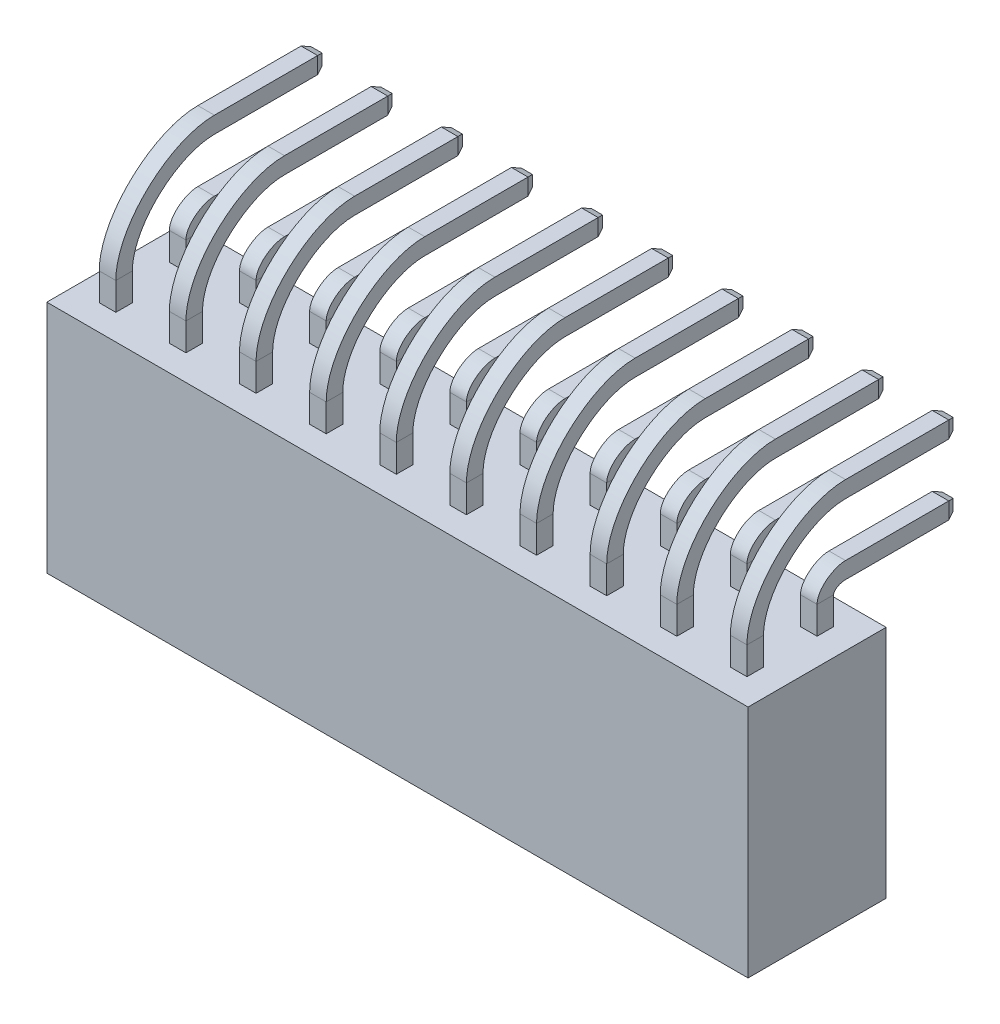
from build123d import *

# Parameters (mm, degrees)
SKETCH_1_W                          = 25.4
SKETCH_1_H                          = 8.5
EXTRUDE_1_DEPTH                     = 5
SKETCH_2_W                          = 0.85
SKETCH_2_H                          = 0.85
CUT_EXTRUDE_1_DEPTH                 = 6
CHAMFER_3_SIZE                      = 0.6
CHAMFER_3_SIZE2                     = 0.48587042
PATTERN_LINEAR_1_COUNT              = 10
PATTERN_LINEAR_1_PITCH              = 2.54
CHAMFER_3_OF_PATTERN_LINEAR_1_SIZE2 = 0.48587042
CHAMFER_3_OF_PATTERN_LINEAR_1_SIZE  = 0.6
SKETCH_3_W                          = 0.6
SKETCH_3_H                          = 0.6
EXTRUDE_2_DEPTH                     = 1
EXTRUDE_2_2_DEPTH                   = 1
EXTRUDE_3_DEPTH                     = 0.5
EXTRUDE_3_DEPTH_BACK                = 3.5
SKETCH_4_W                          = 0.6
SKETCH_4_H                          = 0.6
EXTRUDE_3_2_DEPTH                   = 0.5
EXTRUDE_3_2_DEPTH_BACK              = 3.5
LOFT_START                          = 11.13
LOFT_1_DEPTH                        = 0.6
LOFT_2_DEPTH                        = 0.6
CHAMFER_1_SIZE                      = 0.1
CHAMFER_1_SIZE2                     = 0.260508906
CHAMFER_2_SIZE                      = 0.1
CHAMFER_2_SIZE2                     = 0.260508906
PATTERN_LINEAR_2_COUNT              = 10
PATTERN_LINEAR_2_PITCH              = 2.54


# Read off the part's stored shape, not the designer's step: По сечениям1, По сечениям2
with BuildPart() as part:
    # Эскиз1 → Бобышка-Вытянуть1 (new body)
    with BuildSketch(Plane.XY):
        with Locations((0, -7.08)):
            Rectangle(SKETCH_1_W, SKETCH_1_H)
    extrude(amount=EXTRUDE_1_DEPTH)

    # Эскиз2 → Вырез-Вытянуть1 (cut)
    with BuildSketch(Plane.XZ.offset(11.33)):
        with Locations((11.43, 1.23)):
            Rectangle(SKETCH_2_W, SKETCH_2_H)
        with Locations((11.43, 3.77)):
            Rectangle(SKETCH_2_W, SKETCH_2_H)
    cut_extrude_1 = extrude(amount=-CUT_EXTRUDE_1_DEPTH, mode=Mode.SUBTRACT)

    # Фаска3
    chamfer_3_edges = [part.edges().sort_by_distance(p)[0] for p in [
        (11.855, -11.33, 1.23),
        (11.43, -11.33, 1.655),
        (11.005, -11.33, 1.23),
        (11.43, -11.33, 0.805),
        (11.855, -11.33, 3.77),
        (11.43, -11.33, 4.195),
        (11.005, -11.33, 3.77),
        (11.43, -11.33, 3.345),
    ]]
    chamfer_3_side = [part.faces().sort_by_distance(p)[0] for p in [
        (-0.131546733, -11.33, 2.5),
    ]]
    chamfer(chamfer_3_edges, length=CHAMFER_3_SIZE, length2=CHAMFER_3_SIZE2, reference=chamfer_3_side[0])

    # Линейный массив1: Вырез-Вытянуть1 ×10
    with Locations(*[(-i * PATTERN_LINEAR_1_PITCH, 0, 0) for i in range(1, PATTERN_LINEAR_1_COUNT)]):
        add(cut_extrude_1, mode=Mode.SUBTRACT)

    # Фаска3 of Линейный массив1
    chamfer_3_of_pattern_linear_1_edges = [part.edges().sort_by_distance(p)[0] for p in [
        (9.315, -11.33, 1.23),
        (8.89, -11.33, 1.655),
        (8.465, -11.33, 1.23),
        (8.89, -11.33, 0.805),
        (9.315, -11.33, 3.77),
        (8.89, -11.33, 4.195),
        (8.465, -11.33, 3.77),
        (8.89, -11.33, 3.345),
        (6.775, -11.33, 1.23),
        (6.35, -11.33, 1.655),
        (5.925, -11.33, 1.23),
        (6.35, -11.33, 0.805),
        (6.775, -11.33, 3.77),
        (6.35, -11.33, 4.195),
        (5.925, -11.33, 3.77),
        (6.35, -11.33, 3.345),
        (4.235, -11.33, 1.23),
        (3.81, -11.33, 1.655),
        (3.385, -11.33, 1.23),
        (3.81, -11.33, 0.805),
        (4.235, -11.33, 3.77),
        (3.81, -11.33, 4.195),
        (3.385, -11.33, 3.77),
        (3.81, -11.33, 3.345),
        (1.695, -11.33, 1.23),
        (1.27, -11.33, 1.655),
        (0.845, -11.33, 1.23),
        (1.27, -11.33, 0.805),
        (1.695, -11.33, 3.77),
        (1.27, -11.33, 4.195),
        (0.845, -11.33, 3.77),
        (1.27, -11.33, 3.345),
        (-0.845, -11.33, 1.23),
        (-1.27, -11.33, 1.655),
        (-1.695, -11.33, 1.23),
        (-1.27, -11.33, 0.805),
        (-0.845, -11.33, 3.77),
        (-1.27, -11.33, 4.195),
        (-1.695, -11.33, 3.77),
        (-1.27, -11.33, 3.345),
        (-3.385, -11.33, 1.23),
        (-3.81, -11.33, 1.655),
        (-4.235, -11.33, 1.23),
        (-3.81, -11.33, 0.805),
        (-3.385, -11.33, 3.77),
        (-3.81, -11.33, 4.195),
        (-4.235, -11.33, 3.77),
        (-3.81, -11.33, 3.345),
        (-5.925, -11.33, 1.23),
        (-6.35, -11.33, 1.655),
        (-6.775, -11.33, 1.23),
        (-6.35, -11.33, 0.805),
        (-5.925, -11.33, 3.77),
        (-6.35, -11.33, 4.195),
        (-6.775, -11.33, 3.77),
        (-6.35, -11.33, 3.345),
        (-8.465, -11.33, 1.23),
        (-8.89, -11.33, 1.655),
        (-9.315, -11.33, 1.23),
        (-8.89, -11.33, 0.805),
        (-8.465, -11.33, 3.77),
        (-8.89, -11.33, 4.195),
        (-9.315, -11.33, 3.77),
        (-8.89, -11.33, 3.345),
        (-11.005, -11.33, 1.23),
        (-11.43, -11.33, 1.655),
        (-11.855, -11.33, 1.23),
        (-11.43, -11.33, 0.805),
        (-11.005, -11.33, 3.77),
        (-11.43, -11.33, 4.195),
        (-11.855, -11.33, 3.77),
        (-11.43, -11.33, 3.345),
    ]]
    chamfer(chamfer_3_of_pattern_linear_1_edges, length=CHAMFER_3_OF_PATTERN_LINEAR_1_SIZE, length2=CHAMFER_3_OF_PATTERN_LINEAR_1_SIZE2)


with BuildPart() as body_2:
    # Эскиз3 → Бобышка-Вытянуть2 (new body)
    with BuildSketch(Plane(origin=(0, -2.83, 0), x_dir=(1, 0, 0), z_dir=(0, 1, 0))):
        with Locations((11.43, -3.77)):
            Rectangle(SKETCH_3_W, SKETCH_3_H)
    extrude(amount=EXTRUDE_2_DEPTH)


with BuildPart() as body_3:
    # Эскиз3 → Extrude 2 2 (new body)
    with BuildSketch(Plane(origin=(0, -2.83, 0), x_dir=(1, 0, 0), z_dir=(0, 1, 0))):
        with Locations((11.43, -1.23)):
            Rectangle(SKETCH_3_W, SKETCH_3_H)
    extrude(amount=EXTRUDE_2_2_DEPTH)


with BuildPart() as body_4:
    # Эскиз4 → Бобышка-Вытянуть3 (new, two sides: drawn at the far end of the back side and taken through both)
    with BuildSketch(Plane.XY.offset(-EXTRUDE_3_DEPTH_BACK)):
        with Locations((11.43, -1.27)):
            Rectangle(SKETCH_4_W, SKETCH_4_H)
    extrude(amount=EXTRUDE_3_DEPTH + EXTRUDE_3_DEPTH_BACK)

    # По сечениям1 outline → По сечениям1 (add)
    with BuildSketch(Plane.YZ.offset(LOFT_START)):
        with BuildLine():
            add(Edge.make_bspline(
                [(-1.57, 0.5), (-1.57, 0.667497927), (-1.662502073, 0.93), (-1.83, 0.93)],
                knots=[0, 0, 0, 0, 1, 1, 1, 1], degree=3))
            Line((-1.57, 0.5), (-0.97, 0.5))
            add(Edge.make_bspline(
                [(-0.97, 0.5), (-0.97, 0.947275704), (-1.382724296, 1.53), (-1.83, 1.53)],
                knots=[0, 0, 0, 0, 1, 1, 1, 1], degree=3))
            Line((-1.83, 1.53), (-1.83, 0.93))
        make_face()
    extrude(amount=LOFT_1_DEPTH)

    # Фаска1
    chamfer_1_edges = [body_4.edges().sort_by_distance(p)[0] for p in [
        (11.13, -1.27, -3.5),
        (11.43, -1.57, -3.5),
        (11.73, -1.27, -3.5),
        (11.43, -0.97, -3.5),
    ]]
    chamfer_1_side = [body_4.faces().sort_by_distance(p)[0] for p in [
        (11.43, -1.27, -3.5),
    ]]
    chamfer(chamfer_1_edges, length=CHAMFER_1_SIZE, length2=CHAMFER_1_SIZE2, reference=chamfer_1_side[0])


with BuildPart() as body_5:
    # Эскиз4 → Extrude 3 2 (new, two sides: drawn at the far end of the back side and taken through both)
    with BuildSketch(Plane.XY.offset(-EXTRUDE_3_2_DEPTH_BACK)):
        with Locations((11.43, 1.27)):
            Rectangle(SKETCH_4_W, SKETCH_4_H)
    extrude(amount=EXTRUDE_3_2_DEPTH + EXTRUDE_3_2_DEPTH_BACK)

    # По сечениям2 outline → По сечениям2 (add)
    with BuildSketch(Plane.YZ.offset(LOFT_START)):
        with BuildLine():
            add(Edge.make_bspline(
                [(0.97, 0.5), (0.97, 1.860592191), (-0.469407809, 3.47), (-1.83, 3.47)],
                knots=[0, 0, 0, 0, 1, 1, 1, 1], degree=3))
            Line((0.97, 0.5), (1.57, 0.5))
            add(Edge.make_bspline(
                [(1.57, 0.5), (1.57, 2.143333333), (-0.186666667, 4.07), (-1.83, 4.07)],
                knots=[0, 0, 0, 0, 1, 1, 1, 1], degree=3))
            Line((-1.83, 4.07), (-1.83, 3.47))
        make_face()
    extrude(amount=LOFT_2_DEPTH)

    # Фаска2
    chamfer_2_edges = [body_5.edges().sort_by_distance(p)[0] for p in [
        (11.13, 1.27, -3.5),
        (11.43, 0.97, -3.5),
        (11.73, 1.27, -3.5),
        (11.43, 1.57, -3.5),
    ]]
    chamfer_2_side = [body_5.faces().sort_by_distance(p)[0] for p in [
        (11.43, 1.27, -3.5),
    ]]
    chamfer(chamfer_2_edges, length=CHAMFER_2_SIZE, length2=CHAMFER_2_SIZE2, reference=chamfer_2_side[0])


with BuildPart() as pattern_linear_2_1:
    # Линейный массив2: pattern copy
    add(body_4.part.moved(Location(Vector(-1, 0, 0) * (1 * PATTERN_LINEAR_2_PITCH))))


with BuildPart() as pattern_linear_2_2:
    # Линейный массив2: pattern copy
    add(body_4.part.moved(Location(Vector(-1, 0, 0) * (2 * PATTERN_LINEAR_2_PITCH))))


with BuildPart() as pattern_linear_2_3:
    # Линейный массив2: pattern copy
    add(body_4.part.moved(Location(Vector(-1, 0, 0) * (3 * PATTERN_LINEAR_2_PITCH))))


with BuildPart() as pattern_linear_2_4:
    # Линейный массив2: pattern copy
    add(body_4.part.moved(Location(Vector(-1, 0, 0) * (4 * PATTERN_LINEAR_2_PITCH))))


with BuildPart() as pattern_linear_2_5:
    # Линейный массив2: pattern copy
    add(body_4.part.moved(Location(Vector(-1, 0, 0) * (5 * PATTERN_LINEAR_2_PITCH))))


with BuildPart() as pattern_linear_2_6:
    # Линейный массив2: pattern copy
    add(body_4.part.moved(Location(Vector(-1, 0, 0) * (6 * PATTERN_LINEAR_2_PITCH))))


with BuildPart() as pattern_linear_2_7:
    # Линейный массив2: pattern copy
    add(body_4.part.moved(Location(Vector(-1, 0, 0) * (7 * PATTERN_LINEAR_2_PITCH))))


with BuildPart() as pattern_linear_2_8:
    # Линейный массив2: pattern copy
    add(body_4.part.moved(Location(Vector(-1, 0, 0) * (8 * PATTERN_LINEAR_2_PITCH))))


with BuildPart() as pattern_linear_2_9:
    # Линейный массив2: pattern copy
    add(body_4.part.moved(Location(Vector(-1, 0, 0) * (9 * PATTERN_LINEAR_2_PITCH))))


with BuildPart() as pattern_linear_2_10:
    # Линейный массив2: pattern copy
    add(body_5.part.moved(Location(Vector(-1, 0, 0) * (1 * PATTERN_LINEAR_2_PITCH))))


with BuildPart() as pattern_linear_2_11:
    # Линейный массив2: pattern copy
    add(body_5.part.moved(Location(Vector(-1, 0, 0) * (2 * PATTERN_LINEAR_2_PITCH))))


with BuildPart() as pattern_linear_2_12:
    # Линейный массив2: pattern copy
    add(body_5.part.moved(Location(Vector(-1, 0, 0) * (3 * PATTERN_LINEAR_2_PITCH))))


with BuildPart() as pattern_linear_2_13:
    # Линейный массив2: pattern copy
    add(body_5.part.moved(Location(Vector(-1, 0, 0) * (4 * PATTERN_LINEAR_2_PITCH))))


with BuildPart() as pattern_linear_2_14:
    # Линейный массив2: pattern copy
    add(body_5.part.moved(Location(Vector(-1, 0, 0) * (5 * PATTERN_LINEAR_2_PITCH))))


with BuildPart() as pattern_linear_2_15:
    # Линейный массив2: pattern copy
    add(body_5.part.moved(Location(Vector(-1, 0, 0) * (6 * PATTERN_LINEAR_2_PITCH))))


with BuildPart() as pattern_linear_2_16:
    # Линейный массив2: pattern copy
    add(body_5.part.moved(Location(Vector(-1, 0, 0) * (7 * PATTERN_LINEAR_2_PITCH))))


with BuildPart() as pattern_linear_2_17:
    # Линейный массив2: pattern copy
    add(body_5.part.moved(Location(Vector(-1, 0, 0) * (8 * PATTERN_LINEAR_2_PITCH))))


with BuildPart() as pattern_linear_2_18:
    # Линейный массив2: pattern copy
    add(body_5.part.moved(Location(Vector(-1, 0, 0) * (9 * PATTERN_LINEAR_2_PITCH))))


with BuildPart() as pattern_linear_2_19:
    # Линейный массив2: pattern copy
    add(body_2.part.moved(Location(Vector(-1, 0, 0) * (1 * PATTERN_LINEAR_2_PITCH))))


with BuildPart() as pattern_linear_2_20:
    # Линейный массив2: pattern copy
    add(body_2.part.moved(Location(Vector(-1, 0, 0) * (2 * PATTERN_LINEAR_2_PITCH))))


with BuildPart() as pattern_linear_2_21:
    # Линейный массив2: pattern copy
    add(body_2.part.moved(Location(Vector(-1, 0, 0) * (3 * PATTERN_LINEAR_2_PITCH))))


with BuildPart() as pattern_linear_2_22:
    # Линейный массив2: pattern copy
    add(body_2.part.moved(Location(Vector(-1, 0, 0) * (4 * PATTERN_LINEAR_2_PITCH))))


with BuildPart() as pattern_linear_2_23:
    # Линейный массив2: pattern copy
    add(body_2.part.moved(Location(Vector(-1, 0, 0) * (5 * PATTERN_LINEAR_2_PITCH))))


with BuildPart() as pattern_linear_2_24:
    # Линейный массив2: pattern copy
    add(body_2.part.moved(Location(Vector(-1, 0, 0) * (6 * PATTERN_LINEAR_2_PITCH))))


with BuildPart() as pattern_linear_2_25:
    # Линейный массив2: pattern copy
    add(body_2.part.moved(Location(Vector(-1, 0, 0) * (7 * PATTERN_LINEAR_2_PITCH))))


with BuildPart() as pattern_linear_2_26:
    # Линейный массив2: pattern copy
    add(body_2.part.moved(Location(Vector(-1, 0, 0) * (8 * PATTERN_LINEAR_2_PITCH))))


with BuildPart() as pattern_linear_2_27:
    # Линейный массив2: pattern copy
    add(body_2.part.moved(Location(Vector(-1, 0, 0) * (9 * PATTERN_LINEAR_2_PITCH))))


with BuildPart() as pattern_linear_2_28:
    # Линейный массив2: pattern copy
    add(body_3.part.moved(Location(Vector(-1, 0, 0) * (1 * PATTERN_LINEAR_2_PITCH))))


with BuildPart() as pattern_linear_2_29:
    # Линейный массив2: pattern copy
    add(body_3.part.moved(Location(Vector(-1, 0, 0) * (2 * PATTERN_LINEAR_2_PITCH))))


with BuildPart() as pattern_linear_2_30:
    # Линейный массив2: pattern copy
    add(body_3.part.moved(Location(Vector(-1, 0, 0) * (3 * PATTERN_LINEAR_2_PITCH))))


with BuildPart() as pattern_linear_2_31:
    # Линейный массив2: pattern copy
    add(body_3.part.moved(Location(Vector(-1, 0, 0) * (4 * PATTERN_LINEAR_2_PITCH))))


with BuildPart() as pattern_linear_2_32:
    # Линейный массив2: pattern copy
    add(body_3.part.moved(Location(Vector(-1, 0, 0) * (5 * PATTERN_LINEAR_2_PITCH))))


with BuildPart() as pattern_linear_2_33:
    # Линейный массив2: pattern copy
    add(body_3.part.moved(Location(Vector(-1, 0, 0) * (6 * PATTERN_LINEAR_2_PITCH))))


with BuildPart() as pattern_linear_2_34:
    # Линейный массив2: pattern copy
    add(body_3.part.moved(Location(Vector(-1, 0, 0) * (7 * PATTERN_LINEAR_2_PITCH))))


with BuildPart() as pattern_linear_2_35:
    # Линейный массив2: pattern copy
    add(body_3.part.moved(Location(Vector(-1, 0, 0) * (8 * PATTERN_LINEAR_2_PITCH))))


with BuildPart() as pattern_linear_2_36:
    # Линейный массив2: pattern copy
    add(body_3.part.moved(Location(Vector(-1, 0, 0) * (9 * PATTERN_LINEAR_2_PITCH))))


solid = Compound([part.part, body_2.part, body_3.part, body_4.part, body_5.part, pattern_linear_2_1.part, pattern_linear_2_2.part, pattern_linear_2_3.part, pattern_linear_2_4.part, pattern_linear_2_5.part, pattern_linear_2_6.part, pattern_linear_2_7.part, pattern_linear_2_8.part, pattern_linear_2_9.part, pattern_linear_2_10.part, pattern_linear_2_11.part, pattern_linear_2_12.part, pattern_linear_2_13.part, pattern_linear_2_14.part, pattern_linear_2_15.part, pattern_linear_2_16.part, pattern_linear_2_17.part, pattern_linear_2_18.part, pattern_linear_2_19.part, pattern_linear_2_20.part, pattern_linear_2_21.part, pattern_linear_2_22.part, pattern_linear_2_23.part, pattern_linear_2_24.part, pattern_linear_2_25.part, pattern_linear_2_26.part, pattern_linear_2_27.part, pattern_linear_2_28.part, pattern_linear_2_29.part, pattern_linear_2_30.part, pattern_linear_2_31.part, pattern_linear_2_32.part, pattern_linear_2_33.part, pattern_linear_2_34.part, pattern_linear_2_35.part, pattern_linear_2_36.part])
